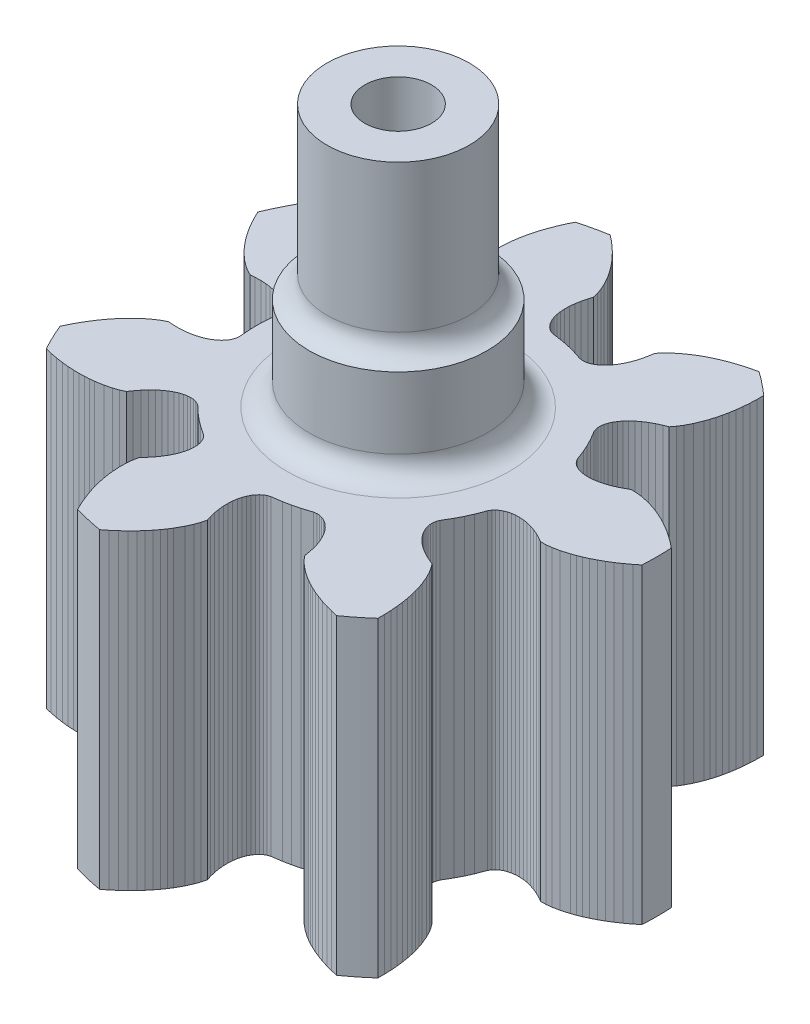
from build123d import *

# Parameters (mm, degrees)
SKETCH1_R           = 2
BOSS_EXTRUDE1_DEPTH = 2.1
SKETCH2_R           = 1.6
BOSS_EXTRUDE3_DEPTH = 3.8
BOSS_EXTRUDE4_DEPTH = 7
SKETCH3_R           = 0.75
CUT_EXTRUDE1_DEPTH  = 11.758401256
SKETCH3_3_R         = 1.1
SKETCH3_3_R_2       = 0.75
CUT_EXTRUDE2_DEPTH  = 11.758401256
FILLET1_R           = 0.5
CHAMFER1_SIZE       = 0.4


with BuildPart() as part:
    # Sketch1 → Boss-Extrude1 (new body)
    with BuildSketch(Plane(origin=(0, 0, 0), x_dir=(1, 0, 0), z_dir=(0, 1, 0))):
        with Locations(Location((0, 0, 0), (0, 0, 270))):
            Circle(SKETCH1_R)
    extrude(amount=BOSS_EXTRUDE1_DEPTH)

    # Sketch2 → Boss-Extrude3 (add)
    with BuildSketch(Plane(origin=(0, 2.1, 0), x_dir=(1, 0, 0), z_dir=(0, 1, 0))):
        with Locations(Location((0, 0, 0), (0, 0, 90))):
            Circle(SKETCH2_R)
    extrude(amount=BOSS_EXTRUDE3_DEPTH)

    # Sketch4 → Boss-Extrude4 (add)
    with BuildSketch(Plane.XZ):
        with BuildLine():
            Line((-1.677656104, -5.457545802), (-1.740166904, -5.314388502))
            Line((-1.740166904, -5.314388502), (-1.793915704, -5.175673402))
            Line((-1.793915704, -5.175673402), (-1.839244704, -5.042342702))
            Line((-1.839244704, -5.042342702), (-1.876421604, -4.915999102))
            Line((-1.876421604, -4.915999102), (-1.907053904, -4.793237402))
            Line((-1.907053904, -4.793237402), (-1.931099704, -4.676009702))
            Line((-1.931099704, -4.676009702), (-1.948773704, -4.566830802))
            Line((-1.948773704, -4.566830802), (-1.961024804, -4.464035702))
            Line((-1.961024804, -4.464035702), (-1.971502404, -4.279785302))
            Line((-1.971502404, -4.279785302), (-1.967365804, -4.124635702))
            Line((-1.967365804, -4.124635702), (-1.953730504, -4.000928102))
            Line((-1.953730504, -4.000928102), (-1.930260404, -3.886700602))
            Line((-1.930260404, -3.886700602), (-1.859391804, -3.809735002))
            Line((-1.859391804, -3.809735002), (-1.778417204, -3.712510502))
            Line((-1.778417204, -3.712510502), (-1.708697804, -3.615493902))
            Line((-1.708697804, -3.615493902), (-1.650076104, -3.519450202))
            Line((-1.650076104, -3.519450202), (-1.602332404, -3.425130202))
            Line((-1.602332404, -3.425130202), (-1.565200104, -3.333258302))
            Line((-1.565200104, -3.333258302), (-1.538382904, -3.244569502))
            Line((-1.538382904, -3.244569502), (-1.521548504, -3.159737902))
            Line((-1.521548504, -3.159737902), (-1.514299404, -3.079451802))
            Line((-1.514299404, -3.079451802), (-1.516222204, -3.004347502))
            Line((-1.516222204, -3.004347502), (-1.526863004, -2.935043002))
            Line((-1.526863004, -2.935043002), (-1.545721204, -2.872129302))
            Line((-1.545721204, -2.872129302), (-1.572279104, -2.816160102))
            Line((-1.572279104, -2.816160102), (-1.605971904, -2.767662302))
            Line((-1.605971904, -2.767662302), (-1.657232504, -2.718290402))
            Line((-1.657232504, -2.718290402), (-1.844744204, -2.592775302))
            Line((-1.844744204, -2.592775302), (-1.984007204, -2.487817902))
            Line((-1.984007204, -2.487817902), (-2.117322004, -2.375401802))
            Line((-2.117322004, -2.375401802), (-2.281415504, -2.220521102))
            Line((-2.281415504, -2.220521102), (-2.340956004, -2.181532002))
            Line((-2.340956004, -2.181532002), (-2.395735304, -2.159475702))
            Line((-2.395735304, -2.159475702), (-2.456210904, -2.146038102))
            Line((-2.456210904, -2.146038102), (-2.521743604, -2.141652302))
            Line((-2.521743604, -2.141652302), (-2.591678304, -2.146699902))
            Line((-2.591678304, -2.146699902), (-2.665327304, -2.161537602))
            Line((-2.665327304, -2.161537602), (-2.741987504, -2.186470302))
            Line((-2.741987504, -2.186470302), (-2.820946104, -2.221759402))
            Line((-2.820946104, -2.221759402), (-2.901443904, -2.267639402))
            Line((-2.901443904, -2.267639402), (-2.982749704, -2.324284202))
            Line((-2.982749704, -2.324284202), (-3.064080904, -2.391819002))
            Line((-3.064080904, -2.391819002), (-3.144672004, -2.470342602))
            Line((-3.144672004, -2.470342602), (-3.223742204, -2.559902302))
            Line((-3.223742204, -2.559902302), (-3.300510504, -2.660481102))
            Line((-3.300510504, -2.660481102), (-3.359776704, -2.746699402))
            Line((-3.359776704, -2.746699402), (-3.465917704, -2.794999002))
            Line((-3.465917704, -2.794999002), (-3.583489604, -2.835820002))
            Line((-3.583489604, -2.835820002), (-3.733828804, -2.874377002))
            Line((-3.733828804, -2.874377002), (-3.915791104, -2.905161502))
            Line((-3.915791104, -2.905161502), (-4.018735004, -2.916091602))
            Line((-4.018735004, -2.916091602), (-4.129109504, -2.923155402))
            Line((-4.129109504, -2.923155402), (-4.248748704, -2.925798102))
            Line((-4.248748704, -2.925798102), (-4.375248804, -2.923250802))
            Line((-4.375248804, -2.923250802), (-4.506697404, -2.915120202))
            Line((-4.506697404, -2.915120202), (-4.646771904, -2.900596502))
            Line((-4.646771904, -2.900596502), (-4.793969404, -2.879062302))
            Line((-4.793969404, -2.879062302), (-4.947447304, -2.849974302))
            Line((-4.947447304, -2.849974302), (-5.090225304, -2.816749202))
            ThreePointArc((-5.090225304, -2.816749202), (-5.241476502, -2.524161997), (-5.375926806, -2.223483907))
            Line((-5.375926806, -2.223483907), (-5.312882596, -2.091140098))
            Line((-5.312882596, -2.091140098), (-5.239932596, -1.953010098))
            Line((-5.239932596, -1.953010098), (-5.164992596, -1.824500098))
            Line((-5.164992596, -1.824500098), (-5.089012596, -1.705930098))
            Line((-5.089012596, -1.705930098), (-5.013412596, -1.598090098))
            Line((-5.013412596, -1.598090098), (-4.936532596, -1.497600098))
            Line((-4.936532596, -1.497600098), (-4.859872596, -1.405710098))
            Line((-4.859872596, -1.405710098), (-4.785532596, -1.323820098))
            Line((-4.785532596, -1.323820098), (-4.712802596, -1.250150098))
            Line((-4.712802596, -1.250150098), (-4.575282596, -1.127080098))
            Line((-4.575282596, -1.127080098), (-4.451402596, -1.033580098))
            Line((-4.451402596, -1.033580098), (-4.346182596, -0.967110098))
            Line((-4.346182596, -0.967110098), (-4.242242596, -0.914240098))
            Line((-4.242242596, -0.914240098), (-4.137882596, -0.921660098))
            Line((-4.137882596, -0.921660098), (-4.011382596, -0.924350098))
            Line((-4.011382596, -0.924350098), (-3.892062596, -0.918370098))
            Line((-3.892062596, -0.918370098), (-3.780422596, -0.904320098))
            Line((-3.780422596, -0.904320098), (-3.676912596, -0.882840098))
            Line((-3.676912596, -0.882840098), (-3.581932596, -0.854590098))
            Line((-3.581932596, -0.854590098), (-3.495872596, -0.820260098))
            Line((-3.495872596, -0.820260098), (-3.419052596, -0.780530098))
            Line((-3.419052596, -0.780530098), (-3.351762596, -0.736140098))
            Line((-3.351762596, -0.736140098), (-3.294242596, -0.687810098))
            Line((-3.294242596, -0.687810098), (-3.246692596, -0.636280098))
            Line((-3.246692596, -0.636280098), (-3.209262596, -0.582310098))
            Line((-3.209262596, -0.582310098), (-3.182062596, -0.526650098))
            Line((-3.182062596, -0.526650098), (-3.165152596, -0.470070098))
            Line((-3.165152596, -0.470070098), (-3.158512596, -0.399210098))
            Line((-3.158512596, -0.399210098), (-3.177292596, -0.174350098))
            Line((-3.177292596, -0.174350098), (-3.182062596, -3.0098e-05))
            Line((-3.182062596, -3.0098e-05), (-3.177292596, 0.174289902))
            Line((-3.177292596, 0.174289902), (-3.158512596, 0.399149902))
            Line((-3.158512596, 0.399149902), (-3.165152596, 0.470009902))
            Line((-3.165152596, 0.470009902), (-3.182062596, 0.526589902))
            Line((-3.182062596, 0.526589902), (-3.209262596, 0.582249902))
            Line((-3.209262596, 0.582249902), (-3.246692596, 0.636219902))
            Line((-3.246692596, 0.636219902), (-3.294242596, 0.687749902))
            Line((-3.294242596, 0.687749902), (-3.351762596, 0.736079902))
            Line((-3.351762596, 0.736079902), (-3.419052596, 0.780469902))
            Line((-3.419052596, 0.780469902), (-3.495872596, 0.820199902))
            Line((-3.495872596, 0.820199902), (-3.581932596, 0.854529902))
            Line((-3.581932596, 0.854529902), (-3.676912596, 0.882779902))
            Line((-3.676912596, 0.882779902), (-3.780422596, 0.904259902))
            Line((-3.780422596, 0.904259902), (-3.892062596, 0.918309902))
            Line((-3.892062596, 0.918309902), (-4.011382596, 0.924289902))
            Line((-4.011382596, 0.924289902), (-4.137882596, 0.921599902))
            Line((-4.137882596, 0.921599902), (-4.242242596, 0.914179902))
            Line((-4.242242596, 0.914179902), (-4.346182596, 0.967049902))
            Line((-4.346182596, 0.967049902), (-4.451402596, 1.033519902))
            Line((-4.451402596, 1.033519902), (-4.575282596, 1.127019902))
            Line((-4.575282596, 1.127019902), (-4.712802596, 1.250089902))
            Line((-4.712802596, 1.250089902), (-4.785532596, 1.323759902))
            Line((-4.785532596, 1.323759902), (-4.859872596, 1.405649902))
            Line((-4.859872596, 1.405649902), (-4.936532596, 1.497539902))
            Line((-4.936532596, 1.497539902), (-5.013412596, 1.598029902))
            Line((-5.013412596, 1.598029902), (-5.089012596, 1.705869902))
            Line((-5.089012596, 1.705869902), (-5.164992596, 1.824439902))
            Line((-5.164992596, 1.824439902), (-5.239932596, 1.952949902))
            Line((-5.239932596, 1.952949902), (-5.312882596, 2.091079902))
            Line((-5.312882596, 2.091079902), (-5.375926796, 2.223423702))
            ThreePointArc((-5.375926796, 2.223423702), (-5.241476491, 2.524101771), (-5.090225294, 2.816688957))
            Line((-5.090225294, 2.816688957), (-4.947447286, 2.849914054))
            Line((-4.947447286, 2.849914054), (-4.793969386, 2.879002054))
            Line((-4.793969386, 2.879002054), (-4.646771886, 2.900536254))
            Line((-4.646771886, 2.900536254), (-4.506697386, 2.915059954))
            Line((-4.506697386, 2.915059954), (-4.375248786, 2.923190554))
            Line((-4.375248786, 2.923190554), (-4.248748686, 2.925737854))
            Line((-4.248748686, 2.925737854), (-4.129109486, 2.923095154))
            Line((-4.129109486, 2.923095154), (-4.018734986, 2.916031354))
            Line((-4.018734986, 2.916031354), (-3.915791086, 2.905101254))
            Line((-3.915791086, 2.905101254), (-3.733828786, 2.874316754))
            Line((-3.733828786, 2.874316754), (-3.583489586, 2.835759754))
            Line((-3.583489586, 2.835759754), (-3.465917686, 2.794938754))
            Line((-3.465917686, 2.794938754), (-3.359776686, 2.746639154))
            Line((-3.359776686, 2.746639154), (-3.300510486, 2.660420854))
            Line((-3.300510486, 2.660420854), (-3.223742186, 2.559842054))
            Line((-3.223742186, 2.559842054), (-3.144671986, 2.470282354))
            Line((-3.144671986, 2.470282354), (-3.064080886, 2.391758754))
            Line((-3.064080886, 2.391758754), (-2.982749686, 2.324223954))
            Line((-2.982749686, 2.324223954), (-2.901443886, 2.267579154))
            Line((-2.901443886, 2.267579154), (-2.820946086, 2.221699154))
            Line((-2.820946086, 2.221699154), (-2.741987486, 2.186410054))
            Line((-2.741987486, 2.186410054), (-2.665327286, 2.161477354))
            Line((-2.665327286, 2.161477354), (-2.591678286, 2.146639654))
            Line((-2.591678286, 2.146639654), (-2.521743586, 2.141592054))
            Line((-2.521743586, 2.141592054), (-2.456210886, 2.145977854))
            Line((-2.456210886, 2.145977854), (-2.395735286, 2.159415454))
            Line((-2.395735286, 2.159415454), (-2.340955986, 2.181471754))
            Line((-2.340955986, 2.181471754), (-2.281415486, 2.220460854))
            Line((-2.281415486, 2.220460854), (-2.117321986, 2.375341554))
            Line((-2.117321986, 2.375341554), (-1.984007186, 2.487757654))
            Line((-1.984007186, 2.487757654), (-1.844744186, 2.592715054))
            Line((-1.844744186, 2.592715054), (-1.657232486, 2.718230154))
            Line((-1.657232486, 2.718230154), (-1.605971886, 2.767602054))
            Line((-1.605971886, 2.767602054), (-1.572279086, 2.816099854))
            Line((-1.572279086, 2.816099854), (-1.545721186, 2.872069054))
            Line((-1.545721186, 2.872069054), (-1.526862986, 2.934982754))
            Line((-1.526862986, 2.934982754), (-1.516222186, 3.004287254))
            Line((-1.516222186, 3.004287254), (-1.514299386, 3.079391554))
            Line((-1.514299386, 3.079391554), (-1.521548486, 3.159677654))
            Line((-1.521548486, 3.159677654), (-1.538382886, 3.244509254))
            Line((-1.538382886, 3.244509254), (-1.565200086, 3.333198054))
            Line((-1.565200086, 3.333198054), (-1.602332386, 3.425069954))
            Line((-1.602332386, 3.425069954), (-1.650076086, 3.519389954))
            Line((-1.650076086, 3.519389954), (-1.708697786, 3.615433654))
            Line((-1.708697786, 3.615433654), (-1.778417186, 3.712450254))
            Line((-1.778417186, 3.712450254), (-1.859391786, 3.809674754))
            Line((-1.859391786, 3.809674754), (-1.930260386, 3.886640354))
            Line((-1.930260386, 3.886640354), (-1.953730486, 4.000867854))
            Line((-1.953730486, 4.000867854), (-1.967365786, 4.124575454))
            Line((-1.967365786, 4.124575454), (-1.971502386, 4.279725054))
            Line((-1.971502386, 4.279725054), (-1.961024786, 4.463975454))
            Line((-1.961024786, 4.463975454), (-1.948773686, 4.566770554))
            Line((-1.948773686, 4.566770554), (-1.931099686, 4.675949454))
            Line((-1.931099686, 4.675949454), (-1.907053886, 4.793177154))
            Line((-1.907053886, 4.793177154), (-1.876421586, 4.915938854))
            Line((-1.876421586, 4.915938854), (-1.839244686, 5.042282454))
            Line((-1.839244686, 5.042282454), (-1.793915686, 5.175613154))
            Line((-1.793915686, 5.175613154), (-1.740166886, 5.314328254))
            Line((-1.740166886, 5.314328254), (-1.677656086, 5.457485554))
            Line((-1.677656086, 5.457485554), (-1.613492886, 5.589290554))
            ThreePointArc((-1.613492886, 5.589290554), (-1.294584924, 5.671642777), (-0.971527485, 5.735814951))
            Line((-0.971527485, 5.735814951), (-0.856530379, 5.644902123))
            Line((-0.856530379, 5.644902123), (-0.738096579, 5.543044323))
            Line((-0.738096579, 5.543044323), (-0.629484279, 5.441387023))
            Line((-0.629484279, 5.441387023), (-0.530794179, 5.340927723))
            Line((-0.530794179, 5.340927723), (-0.442480579, 5.243226523))
            Line((-0.442480579, 5.243226523), (-0.361617479, 5.145912923))
            Line((-0.361617479, 5.145912923), (-0.289089779, 5.050727423))
            Line((-0.289089779, 5.050727423), (-0.225795179, 4.960029123))
            Line((-0.225795179, 4.960029123), (-0.170156179, 4.872729423))
            Line((-0.170156179, 4.872729423), (-0.080772879, 4.711271723))
            Line((-0.080772879, 4.711271723), (-0.017182979, 4.569691923))
            Line((-0.017182979, 4.569691923), (0.024206821, 4.452319023))
            Line((0.024206821, 4.452319023), (0.052622421, 4.339220423))
            Line((0.052622421, 4.339220423), (0.022166221, 4.239128023))
            Line((0.022166221, 4.239128023), (-0.008605279, 4.116398223))
            Line((-0.008605279, 4.116398223), (-0.029326379, 3.998739123))
            Line((-0.029326379, 3.998739123), (-0.040470879, 3.886771723))
            Line((-0.040470879, 3.886771723), (-0.042562579, 3.781077223))
            Line((-0.042562579, 3.781077223), (-0.036155879, 3.682192323))
            Line((-0.036155879, 3.682192323), (-0.021836779, 3.590650923))
            Line((-0.021836779, 3.590650923), (-0.000196979, 3.506916223))
            Line((-0.000196979, 3.506916223), (0.028106621, 3.431435623))
            Line((0.028106621, 3.431435623), (0.062425521, 3.364603323))
            Line((0.062425521, 3.364603323), (0.102082621, 3.306779023))
            Line((0.102082621, 3.306779023), (0.146370621, 3.258277923))
            Line((0.146370621, 3.258277923), (0.194582521, 3.219374423))
            Line((0.194582521, 3.219374423), (0.245981121, 3.190298123))
            Line((0.245981121, 3.190298123), (0.313586921, 3.168056823))
            Line((0.313586921, 3.168056823), (0.536988121, 3.136329923))
            Line((0.536988121, 3.136329923), (0.707999021, 3.102190423))
            Line((0.707999021, 3.102190423), (0.876887021, 3.058750223))
            Line((0.876887021, 3.058750223), (1.091930421, 2.990405023))
            Line((1.091930421, 2.990405023), (1.162491321, 2.981110623))
            Line((1.162491321, 2.981110623), (1.221415521, 2.985006423))
            Line((1.221415521, 2.985006423), (1.281732621, 2.999139023))
            Line((1.281732621, 2.999139023), (1.342678421, 3.023621123))
            Line((1.342678421, 3.023621123), (1.403497321, 3.058512423))
            Line((1.403497321, 3.058512423), (1.463415021, 3.103835823))
            Line((1.463415021, 3.103835823), (1.521665521, 3.159561023))
            Line((1.521665521, 3.159561023), (1.577493421, 3.225614223))
            Line((1.577493421, 3.225614223), (1.630112821, 3.301877423))
            Line((1.630112821, 3.301877423), (1.678789621, 3.388189823))
            Line((1.678789621, 3.388189823), (1.722764221, 3.484324823))
            Line((1.722764221, 3.484324823), (1.761304221, 3.590039423))
            Line((1.761304221, 3.590039423), (1.793685421, 3.705037123))
            Line((1.793685421, 3.705037123), (1.819211821, 3.828964023))
            Line((1.819211821, 3.828964023), (1.835200121, 3.932358623))
            Line((1.835200121, 3.932358623), (1.909873421, 4.021928023))
            Line((1.909873421, 4.021928023), (1.998090521, 4.109718923))
            Line((1.998090521, 4.109718923), (2.116812121, 4.209687323))
            Line((2.116812121, 4.209687323), (2.267397621, 4.316373723))
            Line((2.267397621, 4.316373723), (2.355404521, 4.370887123))
            Line((2.355404521, 4.370887123), (2.451783521, 4.425141023))
            Line((2.451783521, 4.425141023), (2.558428121, 4.479431523))
            Line((2.558428121, 4.479431523), (2.673506021, 4.532022823))
            Line((2.673506021, 4.532022823), (2.795464821, 4.581730723))
            Line((2.795464821, 4.581730723), (2.927969221, 4.629421523))
            Line((2.927969221, 4.629421523), (3.069932921, 4.673886423))
            Line((3.069932921, 4.673886423), (3.220832621, 4.714270623))
            Line((3.220832621, 4.714270623), (3.363886921, 4.746284823))
            ThreePointArc((3.363886921, 4.746284823), (3.627108363, 4.548298309), (3.878703226, 4.335732528))
            Line((3.878703226, 4.335732528), (3.879324236, 4.189141042))
            Line((3.879324236, 4.189141042), (3.873530936, 4.033038442))
            Line((3.873530936, 4.033038442), (3.861770736, 3.884739642))
            Line((3.861770736, 3.884739642), (3.844760636, 3.744945242))
            Line((3.844760636, 3.744945242), (3.823437436, 3.614983242))
            Line((3.823437436, 3.614983242), (3.797771936, 3.491087842))
            Line((3.797771936, 3.491087842), (3.768573236, 3.375036342))
            Line((3.768573236, 3.375036342), (3.737125936, 3.269001042))
            Line((3.737125936, 3.269001042), (3.703562736, 3.171070342))
            Line((3.703562736, 3.171070342), (3.633059536, 3.000520342))
            Line((3.633059536, 3.000520342), (3.562015636, 2.862530242))
            Line((3.562015636, 2.862530242), (3.496055936, 2.756989642))
            Line((3.496055936, 2.756989642), (3.425348736, 2.664257542))
            Line((3.425348736, 2.664257542), (3.328104136, 2.625662642))
            Line((3.328104136, 2.625662642), (3.212964436, 2.573199942))
            Line((3.212964436, 2.573199942), (3.108055436, 2.516041142))
            Line((3.108055436, 2.516041142), (3.013567336, 2.454943742))
            Line((3.013567336, 2.454943742), (2.929627936, 2.390679642))
            Line((2.929627936, 2.390679642), (2.856311136, 2.324016942))
            Line((2.856311136, 2.324016942), (2.793668936, 2.255746642))
            Line((2.793668936, 2.255746642), (2.741694736, 2.186620242))
            Line((2.741694736, 2.186620242), (2.700328636, 2.117430142))
            Line((2.700328636, 2.117430142), (2.669474536, 2.048929342))
            Line((2.669474536, 2.048929342), (2.648991436, 1.981871242))
            Line((2.648991436, 1.981871242), (2.638684936, 1.917005642))
            Line((2.638684936, 1.917005642), (2.638328536, 1.855056142))
            Line((2.638328536, 1.855056142), (2.647642236, 1.796742342))
            Line((2.647642236, 1.796742342), (2.672404836, 1.730018642))
            Line((2.672404836, 1.730018642), (2.786888136, 1.535575142))
            Line((2.786888136, 1.535575142), (2.866820336, 1.380587942))
            Line((2.866820336, 1.380587942), (2.938157336, 1.221461342))
            Line((2.938157336, 1.221461342), (3.018800236, 1.010721142))
            Line((3.018800236, 1.010721142), (3.055527736, 0.949759542))
            Line((3.055527736, 0.949759542), (3.095312236, 0.906119642))
            Line((3.095312236, 0.906119642), (3.143968536, 0.867773342))
            Line((3.143968536, 0.867773342), (3.201108536, 0.835388342))
            Line((3.201108536, 0.835388342), (3.266307636, 0.809592642))
            Line((3.266307636, 0.809592642), (3.339100936, 0.791005742))
            Line((3.339100936, 0.791005742), (3.418987236, 0.780207842))
            Line((3.418987236, 0.780207842), (3.505437836, 0.777743242))
            Line((3.505437836, 0.777743242), (3.597870436, 0.784153042))
            Line((3.597870436, 0.784153042), (3.695701736, 0.799910942))
            Line((3.695701736, 0.799910942), (3.798280836, 0.825469442))
            Line((3.798280836, 0.825469442), (3.904961036, 0.861249642))
            Line((3.904961036, 0.861249642), (4.015059336, 0.907632842))
            Line((4.015059336, 0.907632842), (4.127864736, 0.964942742))
            Line((4.127864736, 0.964942742), (4.218670436, 1.016908042))
            Line((4.218670436, 1.016908042), (4.335256536, 1.014371642))
            Line((4.335256536, 1.014371642), (4.458896736, 1.000137542))
            Line((4.458896736, 1.000137542), (4.611076836, 0.969646442))
            Line((4.611076836, 0.969646442), (4.788376236, 0.918431942))
            Line((4.788376236, 0.918431942), (4.885867836, 0.883613842))
            Line((4.885867836, 0.883613842), (4.988376636, 0.842088442))
            Line((4.988376636, 0.842088442), (5.097314536, 0.792559942))
            Line((5.097314536, 0.792559942), (5.210181936, 0.735378542))
            Line((5.210181936, 0.735378542), (5.325085236, 0.671019742))
            Line((5.325085236, 0.671019742), (5.444986436, 0.597158342))
            Line((5.444986436, 0.597158342), (5.568263436, 0.513890042))
            Line((5.568263436, 0.513890042), (5.693921436, 0.421091042))
            Line((5.693921436, 0.421091042), (5.808144136, 0.329207242))
            ThreePointArc((5.808144136, 0.329207242), (5.817467929, -3.016e-05), (5.808144136, -0.329267562))
            Line((5.808144136, -0.329267562), (5.693921429, -0.421151358))
            Line((5.693921429, -0.421151358), (5.568263429, -0.513950358))
            Line((5.568263429, -0.513950358), (5.444986429, -0.597218658))
            Line((5.444986429, -0.597218658), (5.325085229, -0.671080058))
            Line((5.325085229, -0.671080058), (5.210181929, -0.735438858))
            Line((5.210181929, -0.735438858), (5.097314529, -0.792620258))
            Line((5.097314529, -0.792620258), (4.988376629, -0.842148758))
            Line((4.988376629, -0.842148758), (4.885867829, -0.883674158))
            Line((4.885867829, -0.883674158), (4.788376229, -0.918492258))
            Line((4.788376229, -0.918492258), (4.611076829, -0.969706758))
            Line((4.611076829, -0.969706758), (4.458896729, -1.000197858))
            Line((4.458896729, -1.000197858), (4.335256529, -1.014431958))
            Line((4.335256529, -1.014431958), (4.218670429, -1.016968358))
            Line((4.218670429, -1.016968358), (4.127864729, -0.965003058))
            Line((4.127864729, -0.965003058), (4.015059329, -0.907693158))
            Line((4.015059329, -0.907693158), (3.904961029, -0.861309958))
            Line((3.904961029, -0.861309958), (3.798280829, -0.825529758))
            Line((3.798280829, -0.825529758), (3.695701729, -0.799971258))
            Line((3.695701729, -0.799971258), (3.597870429, -0.784213358))
            Line((3.597870429, -0.784213358), (3.505437829, -0.777803558))
            Line((3.505437829, -0.777803558), (3.418987229, -0.780268158))
            Line((3.418987229, -0.780268158), (3.339100929, -0.791066058))
            Line((3.339100929, -0.791066058), (3.266307629, -0.809652958))
            Line((3.266307629, -0.809652958), (3.201108529, -0.835448658))
            Line((3.201108529, -0.835448658), (3.143968529, -0.867833658))
            Line((3.143968529, -0.867833658), (3.095312229, -0.906179958))
            Line((3.095312229, -0.906179958), (3.055527729, -0.949819858))
            Line((3.055527729, -0.949819858), (3.018800229, -1.010781458))
            Line((3.018800229, -1.010781458), (2.938157329, -1.221521658))
            Line((2.938157329, -1.221521658), (2.866820329, -1.380648258))
            Line((2.866820329, -1.380648258), (2.786888129, -1.535635458))
            Line((2.786888129, -1.535635458), (2.672404829, -1.730078958))
            Line((2.672404829, -1.730078958), (2.647642229, -1.796802658))
            Line((2.647642229, -1.796802658), (2.638328529, -1.855116458))
            Line((2.638328529, -1.855116458), (2.638684929, -1.917065958))
            Line((2.638684929, -1.917065958), (2.648991429, -1.981931558))
            Line((2.648991429, -1.981931558), (2.669474529, -2.048989658))
            Line((2.669474529, -2.048989658), (2.700328629, -2.117490458))
            Line((2.700328629, -2.117490458), (2.741694729, -2.186680558))
            Line((2.741694729, -2.186680558), (2.793668929, -2.255806958))
            Line((2.793668929, -2.255806958), (2.856311129, -2.324077258))
            Line((2.856311129, -2.324077258), (2.929627929, -2.390739958))
            Line((2.929627929, -2.390739958), (3.013567329, -2.455004058))
            Line((3.013567329, -2.455004058), (3.108055429, -2.516101458))
            Line((3.108055429, -2.516101458), (3.212964429, -2.573260258))
            Line((3.212964429, -2.573260258), (3.328104129, -2.625722958))
            Line((3.328104129, -2.625722958), (3.425348729, -2.664317858))
            Line((3.425348729, -2.664317858), (3.496055929, -2.757049958))
            Line((3.496055929, -2.757049958), (3.562015629, -2.862590558))
            Line((3.562015629, -2.862590558), (3.633059529, -3.000580658))
            Line((3.633059529, -3.000580658), (3.703562729, -3.171130658))
            Line((3.703562729, -3.171130658), (3.737125929, -3.269061358))
            Line((3.737125929, -3.269061358), (3.768573229, -3.375096658))
            Line((3.768573229, -3.375096658), (3.797771929, -3.491148158))
            Line((3.797771929, -3.491148158), (3.823437429, -3.615043558))
            Line((3.823437429, -3.615043558), (3.844760629, -3.745005558))
            Line((3.844760629, -3.745005558), (3.861770729, -3.884799958))
            Line((3.861770729, -3.884799958), (3.873530929, -4.033098758))
            Line((3.873530929, -4.033098758), (3.879324229, -4.189201358))
            Line((3.879324229, -4.189201358), (3.878703229, -4.335792858))
            ThreePointArc((3.878703229, -4.335792858), (3.627108367, -4.548358644), (3.363886927, -4.746345161))
            Line((3.363886927, -4.746345161), (3.220832594, -4.714330914))
            Line((3.220832594, -4.714330914), (3.069932894, -4.673946714))
            Line((3.069932894, -4.673946714), (2.927969194, -4.629481814))
            Line((2.927969194, -4.629481814), (2.795464794, -4.581791014))
            Line((2.795464794, -4.581791014), (2.673505994, -4.532083114))
            Line((2.673505994, -4.532083114), (2.558428094, -4.479491814))
            Line((2.558428094, -4.479491814), (2.451783494, -4.425201314))
            Line((2.451783494, -4.425201314), (2.355404494, -4.370947414))
            Line((2.355404494, -4.370947414), (2.267397594, -4.316434014))
            Line((2.267397594, -4.316434014), (2.116812094, -4.209747614))
            Line((2.116812094, -4.209747614), (1.998090494, -4.109779214))
            Line((1.998090494, -4.109779214), (1.909873394, -4.021988314))
            Line((1.909873394, -4.021988314), (1.835200094, -3.932418914))
            Line((1.835200094, -3.932418914), (1.819211794, -3.829024314))
            Line((1.819211794, -3.829024314), (1.793685394, -3.705097414))
            Line((1.793685394, -3.705097414), (1.761304194, -3.590099714))
            Line((1.761304194, -3.590099714), (1.722764194, -3.484385114))
            Line((1.722764194, -3.484385114), (1.678789594, -3.388250114))
            Line((1.678789594, -3.388250114), (1.630112794, -3.301937714))
            Line((1.630112794, -3.301937714), (1.577493394, -3.225674514))
            Line((1.577493394, -3.225674514), (1.521665494, -3.159621314))
            Line((1.521665494, -3.159621314), (1.463414994, -3.103896114))
            Line((1.463414994, -3.103896114), (1.403497294, -3.058572714))
            Line((1.403497294, -3.058572714), (1.342678394, -3.023681414))
            Line((1.342678394, -3.023681414), (1.281732594, -2.999199314))
            Line((1.281732594, -2.999199314), (1.221415494, -2.985066714))
            Line((1.221415494, -2.985066714), (1.162491294, -2.981170914))
            Line((1.162491294, -2.981170914), (1.091930394, -2.990465314))
            Line((1.091930394, -2.990465314), (0.876886994, -3.058810514))
            Line((0.876886994, -3.058810514), (0.707998994, -3.102250714))
            Line((0.707998994, -3.102250714), (0.536988094, -3.136390214))
            Line((0.536988094, -3.136390214), (0.313586894, -3.168117114))
            Line((0.313586894, -3.168117114), (0.245981094, -3.190358414))
            Line((0.245981094, -3.190358414), (0.194582494, -3.219434714))
            Line((0.194582494, -3.219434714), (0.146370594, -3.258338214))
            Line((0.146370594, -3.258338214), (0.102082594, -3.306839314))
            Line((0.102082594, -3.306839314), (0.062425494, -3.364663614))
            Line((0.062425494, -3.364663614), (0.028106594, -3.431495914))
            Line((0.028106594, -3.431495914), (-0.000197006, -3.506976514))
            Line((-0.000197006, -3.506976514), (-0.021836806, -3.590711214))
            Line((-0.021836806, -3.590711214), (-0.036155906, -3.682252614))
            Line((-0.036155906, -3.682252614), (-0.042562606, -3.781137514))
            Line((-0.042562606, -3.781137514), (-0.040470906, -3.886832014))
            Line((-0.040470906, -3.886832014), (-0.029326406, -3.998799414))
            Line((-0.029326406, -3.998799414), (-0.008605306, -4.116458514))
            Line((-0.008605306, -4.116458514), (0.022166194, -4.239188314))
            Line((0.022166194, -4.239188314), (0.052622394, -4.339280714))
            Line((0.052622394, -4.339280714), (0.024206794, -4.452379314))
            Line((0.024206794, -4.452379314), (-0.017183006, -4.569752214))
            Line((-0.017183006, -4.569752214), (-0.080772906, -4.711332014))
            Line((-0.080772906, -4.711332014), (-0.170156206, -4.872789714))
            Line((-0.170156206, -4.872789714), (-0.225795206, -4.960089414))
            Line((-0.225795206, -4.960089414), (-0.289089806, -5.050787714))
            Line((-0.289089806, -5.050787714), (-0.361617506, -5.145973214))
            Line((-0.361617506, -5.145973214), (-0.442480606, -5.243286814))
            Line((-0.442480606, -5.243286814), (-0.530794206, -5.340988014))
            Line((-0.530794206, -5.340988014), (-0.629484306, -5.441447314))
            Line((-0.629484306, -5.441447314), (-0.738096606, -5.543104614))
            Line((-0.738096606, -5.543104614), (-0.856530406, -5.644962414))
            Line((-0.856530406, -5.644962414), (-0.971527506, -5.735875214))
            ThreePointArc((-0.971527506, -5.735875214), (-1.294584942, -5.671703035), (-1.613492901, -5.589350807))
            Line((-1.613492901, -5.589350807), (-1.677656104, -5.457545802))
        make_face()
    extrude(amount=BOSS_EXTRUDE4_DEPTH)

    # Sketch3 → Cut-Extrude1 (cut, through all)
    with BuildSketch(Plane.XZ):
        with Locations(Location((0, 0, 0), (0, 0, 270))):
            Circle(SKETCH3_R)
    extrude(amount=-CUT_EXTRUDE1_DEPTH, mode=Mode.SUBTRACT)

    # Sketch3<3> → Cut-Extrude2 (cut, through all)
    # profile 1 of 2: a face of its own
    with BuildSketch(Plane.XZ):
        with Locations(Location((0, 0, 0), (0, 0, 90))):
            Circle(SKETCH3_3_R)
        with Locations(Location((0, 0, 0), (0, 0, 270))):
            Circle(SKETCH3_3_R_2, mode=Mode.SUBTRACT)
    # profile 2 of 2: a face of its own
    with BuildSketch(Plane.XZ):
        with Locations(Location((0, 0, 0), (0, 0, 270))):
            Circle(SKETCH3_3_R_2)
    extrude(amount=CUT_EXTRUDE2_DEPTH, mode=Mode.SUBTRACT)

    # Fillet1
    # the kernel refuses this fillet: 0.5 mm, written as the material it adds along each edge
    with BuildSketch(Plane(origin=(0, 0, 0), x_dir=(0, 0, 1), z_dir=(-1, 0, 0))) as fillet1_piece_1:
        with BuildLine():
            CenterArc((2 + FILLET1_R, FILLET1_R), FILLET1_R, 180, 90)
            Line((2, FILLET1_R), (2 - FILLET1_R * 0.02, FILLET1_R))
            Line((2 - FILLET1_R * 0.02, FILLET1_R), (2 - FILLET1_R * 0.02, -FILLET1_R * 0.02))
            Line((2 - FILLET1_R * 0.02, -FILLET1_R * 0.02), (2 + FILLET1_R, -FILLET1_R * 0.02))
            Line((2 + FILLET1_R, -FILLET1_R * 0.02), (2 + FILLET1_R, 0))
        make_face()
    revolve(axis=Axis((0, 0, 0), (0, 1, 0)))
    with BuildSketch(Plane(origin=(0, 2.1, 0), x_dir=(0, 0, -1), z_dir=(1, 0, 0))) as fillet1_piece_2:
        with BuildLine():
            CenterArc((2.1, 0.489897949), FILLET1_R, 180, 78.463040967)
            Line((1.6, 0.489897949), (1.59, 0.489897949))
            Line((1.59, 0.489897949), (1.59, 0))
            Line((1.59, 0), (1.6, -0.01))
            ThreePointArc((1.6, -0.01), (1.8, -0.01), (1.998, -0.009797959))
            Line((1.998, -0.009797959), (2, 0))
        make_face()
    revolve(axis=Axis((0, 2.1, 0), (0, 1, 0)))

    # Chamfer1
    # the kernel refuses this chamfer: 0.4 mm, written as the material it adds along each edge
    with BuildSketch(Plane(origin=(0, 0, 0), x_dir=(0, 0, 1), z_dir=(1, 0, 0))) as chamfer1_piece_1_section:
        Polygon((1.1 - CHAMFER1_SIZE, 0), (1.1, CHAMFER1_SIZE), (1.1, 0), align=None)
    chamfer1_piece_1 = revolve(axis=Axis((0, 0, 0), (0, -1, 0)), mode=Mode.PRIVATE)
    chamfer1_piece_1 = chamfer1_piece_1 - Plane(origin=(0, -0.224951362, 0), x_dir=(0, 0, -1), z_dir=(0, -1, 0)) * Cylinder(0.75, 5, mode=Mode.PRIVATE)
    add(chamfer1_piece_1)
    # the kernel refuses this chamfer: 0.4 mm, written as the material it takes off along each edge
    with BuildSketch(Plane(origin=(0, -7, 0), x_dir=(0, 0, 1), z_dir=(-1, 0, 0))) as chamfer1_2_piece_1:
        Polygon((1.1, CHAMFER1_SIZE), (1.1 + CHAMFER1_SIZE, 0), (1.1, 0), align=None)
    revolve(axis=Axis((0, -7, 0), (0, 1, 0)), mode=Mode.SUBTRACT)


solid = part.part
